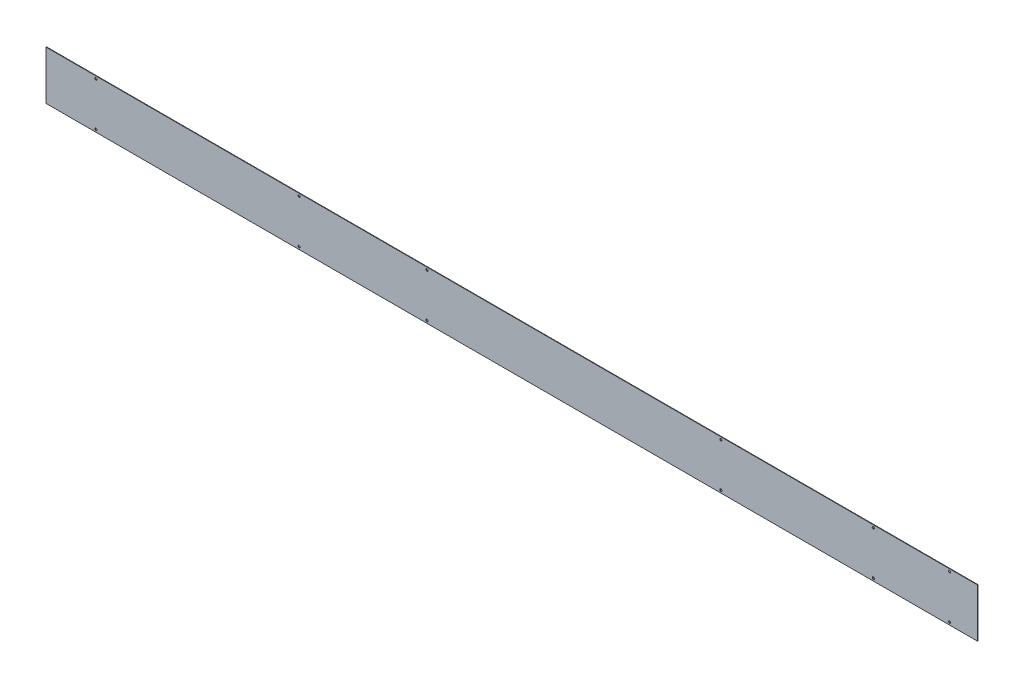
from build123d import *

# Parameters (mm, degrees)
SKETCH2_W               = 1397
SKETCH2_H               = 73.152
BASE_FLANGE1_DEPTH      = 0.75946
CUT_EXTRUDE1_DEPTH      = 700.457382944
CUT_EXTRUDE1_DEPTH_BACK = 700.457382944
SKETCH3_R               = 1.651


# Sheet-metal steps are written as plain solids
with BuildPart() as part:
    # Sketch2 → Base-Flange1 (new body)
    with BuildSketch(Plane.XY):
        Rectangle(SKETCH2_W, SKETCH2_H)
    extrude(amount=-BASE_FLANGE1_DEPTH)

    # Sketch3 → Cut-Extrude1 (cut, two sides: drawn at the far end of the back side and taken through both)
    with BuildSketch(Plane.XY.offset(-CUT_EXTRUDE1_DEPTH_BACK)):
        with Locations((-623.57, 32.766)):
            Circle(SKETCH3_R)
        with Locations((-623.57, -32.766)):
            Circle(SKETCH3_R)
        with Locations((-127, 32.766)):
            Circle(SKETCH3_R)
        with Locations((-127, -32.766)):
            Circle(SKETCH3_R)
        with Locations((313.69, 32.766)):
            Circle(SKETCH3_R)
        with Locations((313.69, -32.766)):
            Circle(SKETCH3_R)
        with Locations((542.29, 32.766)):
            Circle(SKETCH3_R)
        with Locations((542.29, -32.766)):
            Circle(SKETCH3_R)
        with Locations((656.59, 32.766)):
            Circle(SKETCH3_R)
        with Locations((656.59, -32.766)):
            Circle(SKETCH3_R)
        with Locations((-318.77, 32.766)):
            Circle(SKETCH3_R)
        with Locations((-318.77, -32.766)):
            Circle(SKETCH3_R)
    extrude(amount=CUT_EXTRUDE1_DEPTH + CUT_EXTRUDE1_DEPTH_BACK, mode=Mode.SUBTRACT)


solid = part.part
